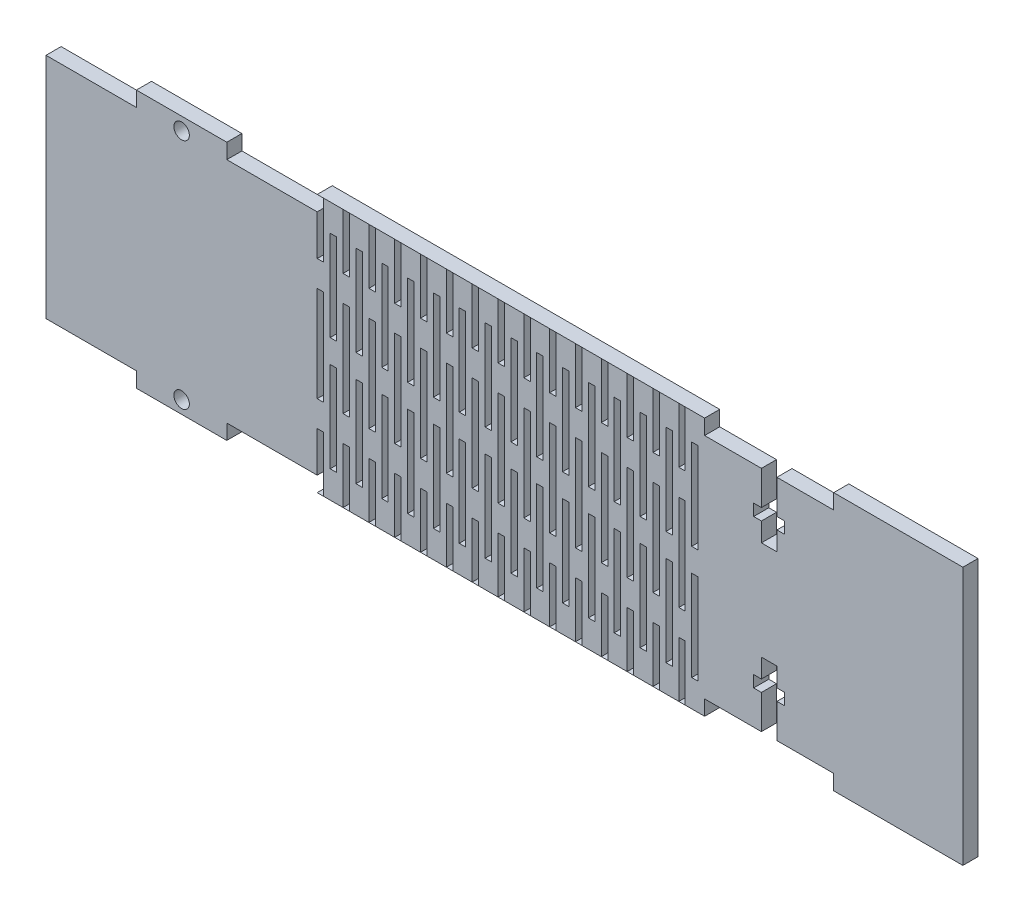
from build123d import *

# Parameters (mm, degrees)
SKETCH1_W           = 180.34
SKETCH1_H           = 50.8
BOSS_EXTRUDE1_DEPTH = 2.9718
SKETCH2_W           = 1.27
SKETCH2_H           = 10.922
SKETCH2_H_2         = 18.796
SKETCH2_H_3         = 17.78
CUT_EXTRUDE1_DEPTH  = 2.9718
SKETCH3_W           = 25.391035659
SKETCH3_H           = 28.388056399
SKETCH3_H_2         = 2.9718
SKETCH3_W_2         = 17.78
CUT_EXTRUDE3_DEPTH  = 2.9718
SKETCH5_R           = 1.524
CUT_EXTRUDE4_DEPTH  = 2.9718


with BuildPart() as part:
    # Sketch1 → Boss-Extrude1 (new body)
    with BuildSketch(Plane.XY):
        Rectangle(SKETCH1_W, SKETCH1_H)
    extrude(amount=BOSS_EXTRUDE1_DEPTH)

    # Sketch2 → Cut-Extrude1 (cut)
    with BuildSketch(Plane.XY.offset(2.9718)):
        with Locations((14.605, 19.93831462)):
            Rectangle(SKETCH2_W, SKETCH2_H)
        with Locations((-36.195, 19.93831462)):
            Rectangle(SKETCH2_W, SKETCH2_H)
        with Locations((34.925, 0)):
            Rectangle(SKETCH2_W, SKETCH2_H_2)
        with Locations((29.845, 0)):
            Rectangle(SKETCH2_W, SKETCH2_H_2)
        with Locations((24.765, 0)):
            Rectangle(SKETCH2_W, SKETCH2_H_2)
        with Locations((19.685, 0)):
            Rectangle(SKETCH2_W, SKETCH2_H_2)
        with Locations((14.605, 0)):
            Rectangle(SKETCH2_W, SKETCH2_H_2)
        with Locations((9.525, 0)):
            Rectangle(SKETCH2_W, SKETCH2_H_2)
        with Locations((4.445, 0)):
            Rectangle(SKETCH2_W, SKETCH2_H_2)
        with Locations((-0.635, 0)):
            Rectangle(SKETCH2_W, SKETCH2_H_2)
        with Locations((-5.715, 0)):
            Rectangle(SKETCH2_W, SKETCH2_H_2)
        with Locations((-10.795, 0)):
            Rectangle(SKETCH2_W, SKETCH2_H_2)
        with Locations((-15.875, 0)):
            Rectangle(SKETCH2_W, SKETCH2_H_2)
        with Locations((-20.955, 0)):
            Rectangle(SKETCH2_W, SKETCH2_H_2)
        with Locations((-26.035, 0)):
            Rectangle(SKETCH2_W, SKETCH2_H_2)
        with Locations((-31.115, 0)):
            Rectangle(SKETCH2_W, SKETCH2_H_2)
        with Locations((-36.195, 0)):
            Rectangle(SKETCH2_W, SKETCH2_H_2)
        with Locations((-36.195, -19.93831462)):
            Rectangle(SKETCH2_W, SKETCH2_H)
        with Locations((12.065, -11.174300882)):
            Rectangle(SKETCH2_W, SKETCH2_H_3)
        with Locations((12.065, 11.174300882)):
            Rectangle(SKETCH2_W, SKETCH2_H_3)
        with Locations((9.525, 19.93831462)):
            Rectangle(SKETCH2_W, SKETCH2_H)
        with Locations((9.525, -19.93831462)):
            Rectangle(SKETCH2_W, SKETCH2_H)
        with Locations((4.445, 19.93831462)):
            Rectangle(SKETCH2_W, SKETCH2_H)
        with Locations((6.985, 11.174300882)):
            Rectangle(SKETCH2_W, SKETCH2_H_3)
        with Locations((4.445, -19.93831462)):
            Rectangle(SKETCH2_W, SKETCH2_H)
        with Locations((6.985, -11.174300882)):
            Rectangle(SKETCH2_W, SKETCH2_H_3)
        with Locations((-0.635, 19.93831462)):
            Rectangle(SKETCH2_W, SKETCH2_H)
        with Locations((1.905, 11.174300882)):
            Rectangle(SKETCH2_W, SKETCH2_H_3)
        with Locations((-0.635, -19.93831462)):
            Rectangle(SKETCH2_W, SKETCH2_H)
        with Locations((1.905, -11.174300882)):
            Rectangle(SKETCH2_W, SKETCH2_H_3)
        with Locations((-5.715, 19.93831462)):
            Rectangle(SKETCH2_W, SKETCH2_H)
        with Locations((-3.175, 11.174300882)):
            Rectangle(SKETCH2_W, SKETCH2_H_3)
        with Locations((-5.715, -19.93831462)):
            Rectangle(SKETCH2_W, SKETCH2_H)
        with Locations((-3.175, -11.174300882)):
            Rectangle(SKETCH2_W, SKETCH2_H_3)
        with Locations((-10.795, 19.93831462)):
            Rectangle(SKETCH2_W, SKETCH2_H)
        with Locations((-8.255, 11.174300882)):
            Rectangle(SKETCH2_W, SKETCH2_H_3)
        with Locations((-10.795, -19.93831462)):
            Rectangle(SKETCH2_W, SKETCH2_H)
        with Locations((-8.255, -11.174300882)):
            Rectangle(SKETCH2_W, SKETCH2_H_3)
        with Locations((-13.335, -11.174300882)):
            Rectangle(SKETCH2_W, SKETCH2_H_3)
        with Locations((-13.335, 11.174300882)):
            Rectangle(SKETCH2_W, SKETCH2_H_3)
        with Locations((-15.875, 19.93831462)):
            Rectangle(SKETCH2_W, SKETCH2_H)
        with Locations((-15.875, -19.93831462)):
            Rectangle(SKETCH2_W, SKETCH2_H)
        with Locations((-18.415, -11.174300882)):
            Rectangle(SKETCH2_W, SKETCH2_H_3)
        with Locations((-18.415, 11.174300882)):
            Rectangle(SKETCH2_W, SKETCH2_H_3)
        with Locations((-20.955, 19.93831462)):
            Rectangle(SKETCH2_W, SKETCH2_H)
        with Locations((-20.955, -19.93831462)):
            Rectangle(SKETCH2_W, SKETCH2_H)
        with Locations((-23.495, -11.174300882)):
            Rectangle(SKETCH2_W, SKETCH2_H_3)
        with Locations((-23.495, 11.174300882)):
            Rectangle(SKETCH2_W, SKETCH2_H_3)
        with Locations((-26.035, 19.93831462)):
            Rectangle(SKETCH2_W, SKETCH2_H)
        with Locations((-26.035, -19.93831462)):
            Rectangle(SKETCH2_W, SKETCH2_H)
        with Locations((-28.575, -11.174300882)):
            Rectangle(SKETCH2_W, SKETCH2_H_3)
        with Locations((-28.575, 11.174300882)):
            Rectangle(SKETCH2_W, SKETCH2_H_3)
        with Locations((-31.115, 19.93831462)):
            Rectangle(SKETCH2_W, SKETCH2_H)
        with Locations((-31.115, -19.93831462)):
            Rectangle(SKETCH2_W, SKETCH2_H)
        with Locations((-33.655, -11.174300882)):
            Rectangle(SKETCH2_W, SKETCH2_H_3)
        with Locations((-33.655, 11.174300882)):
            Rectangle(SKETCH2_W, SKETCH2_H_3)
        with Locations((14.605, -19.93831462)):
            Rectangle(SKETCH2_W, SKETCH2_H)
        with Locations((17.145, 11.174300882)):
            Rectangle(SKETCH2_W, SKETCH2_H_3)
        with Locations((17.145, -11.174300882)):
            Rectangle(SKETCH2_W, SKETCH2_H_3)
        with Locations((19.685, 19.93831462)):
            Rectangle(SKETCH2_W, SKETCH2_H)
        with Locations((19.685, -19.93831462)):
            Rectangle(SKETCH2_W, SKETCH2_H)
        with Locations((22.225, 11.174300882)):
            Rectangle(SKETCH2_W, SKETCH2_H_3)
        with Locations((22.225, -11.174300882)):
            Rectangle(SKETCH2_W, SKETCH2_H_3)
        with Locations((24.765, 19.93831462)):
            Rectangle(SKETCH2_W, SKETCH2_H)
        with Locations((24.765, -19.93831462)):
            Rectangle(SKETCH2_W, SKETCH2_H)
        with Locations((27.305, 11.174300882)):
            Rectangle(SKETCH2_W, SKETCH2_H_3)
        with Locations((27.305, -11.174300882)):
            Rectangle(SKETCH2_W, SKETCH2_H_3)
        with Locations((29.845, 19.93831462)):
            Rectangle(SKETCH2_W, SKETCH2_H)
        with Locations((29.845, -19.93831462)):
            Rectangle(SKETCH2_W, SKETCH2_H)
        with Locations((32.385, 11.174300882)):
            Rectangle(SKETCH2_W, SKETCH2_H_3)
        with Locations((32.385, -11.174300882)):
            Rectangle(SKETCH2_W, SKETCH2_H_3)
        with Locations((34.925, 19.93831462)):
            Rectangle(SKETCH2_W, SKETCH2_H)
        with Locations((34.925, -19.93831462)):
            Rectangle(SKETCH2_W, SKETCH2_H)
        with Locations((37.465, 11.174300882)):
            Rectangle(SKETCH2_W, SKETCH2_H_3)
        with Locations((37.465, -11.174300882)):
            Rectangle(SKETCH2_W, SKETCH2_H_3)
    extrude(amount=-CUT_EXTRUDE1_DEPTH, mode=Mode.SUBTRACT)

    # Sketch3 → Cut-Extrude3 (cut)
    with BuildSketch(Plane.XY.offset(2.9718)):
        with Locations((52.064244059, -36.6222282)):
            Rectangle(SKETCH3_W, SKETCH3_H)
        with Locations((52.064244059, 23.9141)):
            Rectangle(SKETCH3_W, SKETCH3_H_2)
        with Locations((-81.28, 36.6222282)):
            Rectangle(SKETCH3_W_2, SKETCH3_H)
        with Locations((-45.72, 36.6222282)):
            Rectangle(SKETCH3_W_2, SKETCH3_H)
        with Locations((-45.72, -36.6222282)):
            Rectangle(SKETCH3_W_2, SKETCH3_H)
        with Locations((-81.28, -36.6222282)):
            Rectangle(SKETCH3_W_2, SKETCH3_H)
    extrude(amount=-CUT_EXTRUDE3_DEPTH, mode=Mode.SUBTRACT)

    # Sketch5 → Cut-Extrude4 (cut)
    with BuildSketch(Plane.XY.offset(2.9718)):
        Polygon((53.588244058, 22.4282), (50.540244058, 22.4282), (50.540244058, 15.744145307), (49.016244058, 15.744145307), (49.016244058, 13.458145307), (50.540244058, 13.458145307), (50.540244058, 9.7282), (53.588244058, 9.7282), (53.588244058, 13.458145307), (55.112244058, 13.458145307), (55.112244058, 15.744145307), (53.588244058, 15.744145307), align=None)
        Polygon((53.588244058, -9.7282), (50.540244058, -9.7282), (50.540244058, -13.458145307), (49.016244058, -13.458145307), (49.016244058, -15.744145307), (50.540244058, -15.744145307), (50.540244058, -22.4282), (53.588244058, -22.4282), (53.588244058, -15.744145307), (55.112244058, -15.744145307), (55.112244058, -13.458145307), (53.588244058, -13.458145307), align=None)
        with Locations((-63.5, 22.888084873)):
            Circle(SKETCH5_R)
        with Locations((-63.5, -22.888084873)):
            Circle(SKETCH5_R)
    extrude(amount=-CUT_EXTRUDE4_DEPTH, mode=Mode.SUBTRACT)


solid = part.part
